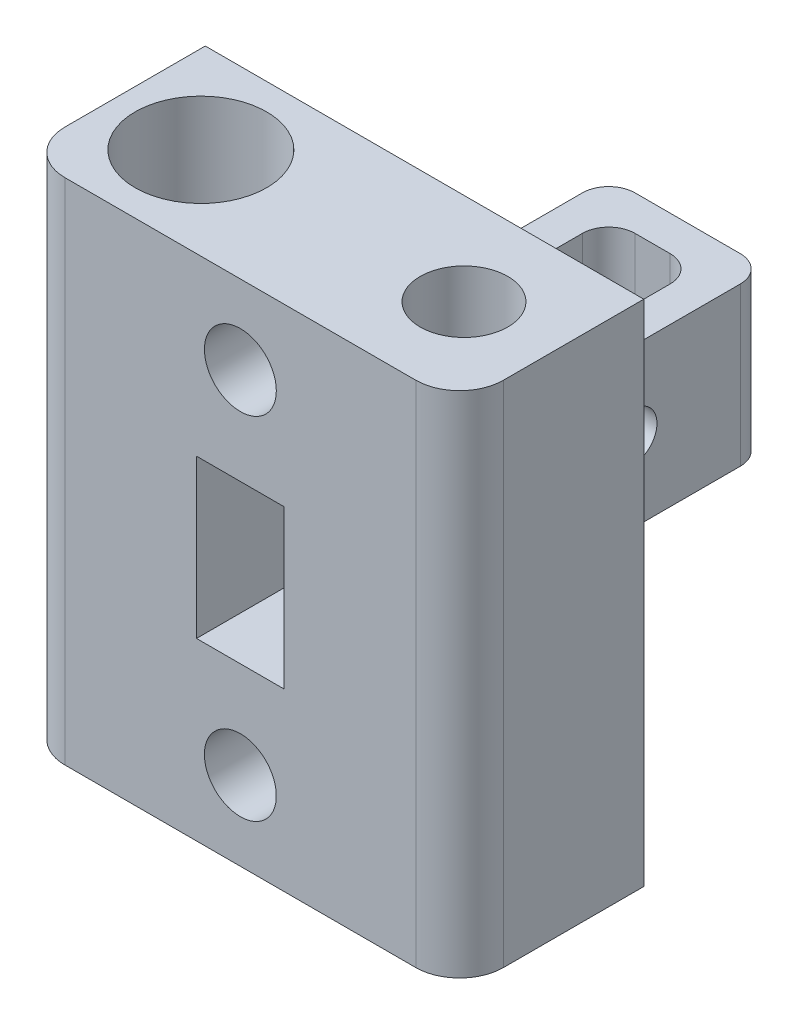
from build123d import *

# Parameters (mm, degrees)
SKETCH1_W           = 50
SKETCH1_H           = 21
BOSS_EXTRUDE1_DEPTH = 58
SKETCH3_R           = 7.5
CUT_EXTRUDE1_DEPTH  = 24
CUT_EXTRUDE2_REACH  = 66.025
SKETCH4_R           = 5
CUT_EXTRUDE3_START  = -24
SKETCH5_R           = 7.5
CUT_EXTRUDE3_DEPTH  = 24
CUT_EXTRUDE4_REACH  = 66.025
SKETCH6_R           = 4.5
CUT_EXTRUDE5_REACH  = 68.558
SKETCH8_W           = 10
SKETCH8_H           = 18
SKETCH7_R           = 4.1
CUT_EXTRUDE6_DEPTH  = 15
SKETCH11_W          = 4
SKETCH11_H          = 18
BOSS_EXTRUDE2_DEPTH = 26
SKETCH12_W          = 18
SKETCH12_H          = 18
BOSS_EXTRUDE3_DEPTH = 4
CUT_EXTRUDE7_DEPTH  = 79.487260113
FILLET1_R           = 5
FILLET2_R           = 5
FILLET3_R           = 3


with BuildPart() as part:
    # Sketch1 → Boss-Extrude1 (new body)
    with BuildSketch(Plane(origin=(0, 0, 0), x_dir=(1, 0, 0), z_dir=(0, 1, 0))):
        Rectangle(SKETCH1_W, SKETCH1_H)
    extrude(amount=BOSS_EXTRUDE1_DEPTH)

    # Sketch3 → Cut-Extrude1 (cut)
    with BuildSketch(Plane(origin=(0, 58, 0), x_dir=(1, 0, 0), z_dir=(0, 1, 0))):
        with Locations((-15, 0)):
            Circle(SKETCH3_R)
    extrude(amount=-CUT_EXTRUDE1_DEPTH, mode=Mode.SUBTRACT)

    # Sketch4 → Cut-Extrude2 (cut, up to next)
    with BuildSketch(Plane(origin=(0, 58, 0), x_dir=(1, 0, 0), z_dir=(0, 1, 0)), mode=Mode.PRIVATE) as cut_extrude2_sk1:
        with Locations((15, 0)):
            Circle(SKETCH4_R)
    cut_extrude2_tool1 = extrude(cut_extrude2_sk1.sketch, amount=-CUT_EXTRUDE2_REACH, mode=Mode.PRIVATE) & part.part
    add(cut_extrude2_tool1.solids().sort_by_distance((15, 58, 0))[0], mode=Mode.SUBTRACT)

    # Sketch5 → Cut-Extrude3 (cut)
    with BuildSketch(Plane.XZ.offset(CUT_EXTRUDE3_START)):
        with Locations((-15, 0)):
            Circle(SKETCH5_R)
    extrude(amount=CUT_EXTRUDE3_DEPTH, mode=Mode.SUBTRACT)

    # Sketch6 → Cut-Extrude4 (cut, up to next)
    with BuildSketch(Plane.XZ, mode=Mode.PRIVATE) as cut_extrude4_sk1:
        with Locations((-15, 0)):
            Circle(SKETCH6_R)
    cut_extrude4_tool1 = extrude(cut_extrude4_sk1.sketch, amount=-CUT_EXTRUDE4_REACH, mode=Mode.PRIVATE) & part.part
    add(cut_extrude4_tool1.solids().sort_by_distance((-15, 0, 0))[0], mode=Mode.SUBTRACT)

    # Sketch8 → Cut-Extrude5 (cut, up to next)
    with BuildSketch(Plane.XY.offset(10.5), mode=Mode.PRIVATE) as cut_extrude5_sk1:
        with Locations((0, 29)):
            Rectangle(SKETCH8_W, SKETCH8_H)
    cut_extrude5_tool1 = extrude(cut_extrude5_sk1.sketch, amount=-CUT_EXTRUDE5_REACH, mode=Mode.PRIVATE) & part.part
    add(cut_extrude5_tool1.solids().sort_by_distance((0, 29, 10.5))[0], mode=Mode.SUBTRACT)

    # Sketch7 → Cut-Extrude6 (cut)
    with BuildSketch(Plane.XY.offset(10.5)):
        with Locations((0, 49)):
            Circle(SKETCH7_R)
        with Locations((0, 9)):
            Circle(SKETCH7_R)
    extrude(amount=-CUT_EXTRUDE6_DEPTH, mode=Mode.SUBTRACT)

    # Sketch11 → Boss-Extrude2 (add)
    with BuildSketch(Plane(origin=(0, 0, -10.5), x_dir=(-1, 0, 0), z_dir=(0, 0, -1))):
        with Locations((7, 29)):
            Rectangle(SKETCH11_W, SKETCH11_H)
        with Locations((-7, 29)):
            Rectangle(SKETCH11_W, SKETCH11_H)
    extrude(amount=BOSS_EXTRUDE2_DEPTH)

    # Sketch12 → Boss-Extrude3 (add)
    with BuildSketch(Plane(origin=(0, 0, -36.5), x_dir=(-1, 0, 0), z_dir=(0, 0, -1))):
        with Locations((0, 29)):
            Rectangle(SKETCH12_W, SKETCH12_H)
    extrude(amount=BOSS_EXTRUDE3_DEPTH)

    # Sketch13 → Cut-Extrude7 (cut, through all)
    with BuildSketch(Plane(origin=(9, 0, 0), x_dir=(0, 0, -1), z_dir=(1, 0, 0))):
        with BuildLine():
            Line((16.25, 31.75), (25.25, 31.75))
            ThreePointArc((25.25, 31.75), (28, 29), (25.25, 26.25))
            Line((25.25, 26.25), (16.25, 26.25))
            ThreePointArc((16.25, 26.25), (13.5, 29), (16.25, 31.75))
        make_face()
    extrude(amount=-CUT_EXTRUDE7_DEPTH, mode=Mode.SUBTRACT)

    # Fillet1
    fillet1_edges = [part.edges().sort_by_distance(p)[0] for p in [
        (-25, 29, 10.5),
        (25, 29, 10.5),
    ]]
    fillet(fillet1_edges, radius=FILLET1_R)

    # Fillet2
    fillet2_edges = [part.edges().sort_by_distance(p)[0] for p in [
        (-7, 20, -10.5),
        (7, 20, -10.5),
        (-7, 38, -10.5),
        (7, 38, -10.5),
    ]]
    fillet(fillet2_edges, radius=FILLET2_R)

    # Fillet3
    fillet3_edges = [part.edges().sort_by_distance(p)[0] for p in [
        (-5, 29, -36.5),
        (5, 29, -36.5),
        (-9, 29, -40.5),
        (9, 29, -40.5),
    ]]
    fillet(fillet3_edges, radius=FILLET3_R)


solid = part.part
